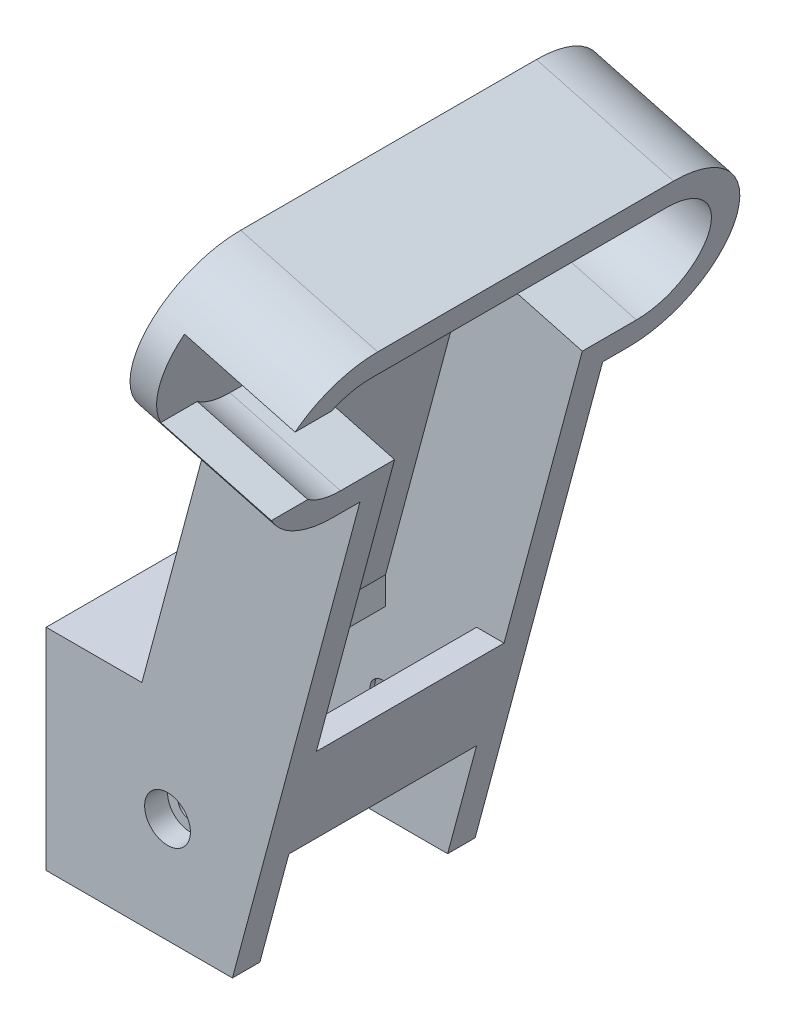
from build123d import *

# Parameters (mm, degrees)
SKETCH1_W                                = 53
SKETCH1_H                                = 53
SKETCH1_W_2                              = 41
SKETCH1_H_2                              = 41
BOSS_EXTRUDE1_DEPTH                      = 40
SKETCH2_W                                = 53
SKETCH2_H                                = 53
BOSS_EXTRUDE2_DEPTH                      = 6
SKETCH3_W                                = 53
SKETCH3_H                                = 80
SKETCH3_W_2                              = 41
SKETCH3_H_2                              = 68
BOSS_EXTRUDE3_DEPTH                      = 31
BOSS_EXTRUDE4_DEPTH                      = 31
BOSS_EXTRUDE5_START                      = -6
BOSS_EXTRUDE5_DEPTH                      = 6
SKETCH6_W                                = 41
SKETCH6_H                                = 12
CUT_EXTRUDE1_DEPTH                       = 25
CBORE_FOR_M3_SHCS2_D                     = 3.4
CBORE_FOR_M3_SHCS2_CBORE_D               = 6.5
CBORE_FOR_M3_SHCS2_CBORE_DEPTH           = 3
CUT_EXTRUDE2_REACH                       = 166.954
SKETCH14_W                               = 41
SKETCH14_H                               = 41
CUT_EXTRUDE3_DEPTH                       = 40
CUT_EXTRUDE4_REACH                       = 127.3
SKETCH15_W                               = 19.88190451
SKETCH15_H                               = 41
CBORE_FOR_M5_SHCS1_D                     = 5.5
CBORE_FOR_M5_SHCS1_DEPTH                 = 6
CBORE_FOR_M5_SHCS1_CBORE_D               = 10
CBORE_FOR_M5_SHCS1_CBORE_DEPTH           = 5
CBORE_FOR_M5_SHCS1_ON_FACE_2_D           = 5.5
CBORE_FOR_M5_SHCS1_ON_FACE_2_DEPTH       = 6
CBORE_FOR_M5_SHCS1_ON_FACE_2_CBORE_D     = 10
CBORE_FOR_M5_SHCS1_ON_FACE_2_CBORE_DEPTH = 5
CBORE_FOR_M5_SHCS1_ON_FACE_3_D           = 5.5
CBORE_FOR_M5_SHCS1_ON_FACE_3_DEPTH       = 6
CBORE_FOR_M5_SHCS1_ON_FACE_3_CBORE_D     = 10
CBORE_FOR_M5_SHCS1_ON_FACE_3_CBORE_DEPTH = 5
CUT_EXTRUDE5_START                       = -26.5
CUT_EXTRUDE5_DEPTH                       = 53


with BuildPart() as part:
    # Sketch1 → Boss-Extrude1 (new body)
    with BuildSketch(Plane(origin=(0, 0, 0), x_dir=(1, 0, 0), z_dir=(0, 1, 0))):
        Rectangle(SKETCH1_W, SKETCH1_H)
        Rectangle(SKETCH1_W_2, SKETCH1_H_2, mode=Mode.SUBTRACT)
    extrude(amount=BOSS_EXTRUDE1_DEPTH)

    # Sketch2 → Boss-Extrude2 (add)
    with BuildSketch(Plane(origin=(0, 40, 0), x_dir=(1, 0, 0), z_dir=(0, 1, 0))):
        Rectangle(SKETCH2_W, SKETCH2_H)
    extrude(amount=BOSS_EXTRUDE2_DEPTH)

    # Sketch3 → Boss-Extrude3 (add)
    with BuildSketch(Plane(origin=(13.2248366, -3.543584287, 0), x_dir=(0, 0, -1), z_dir=(-0.9659258262890681, 0.25881904510252135, 0))):
        with Locations((0, -71.291292705)):
            Rectangle(SKETCH3_W, SKETCH3_H)
        with Locations((0, -71.291292705)):
            Rectangle(SKETCH3_W_2, SKETCH3_H_2, mode=Mode.SUBTRACT)
    extrude(amount=BOSS_EXTRUDE3_DEPTH)

    # Sketch4 → Boss-Extrude4 (add)
    with BuildSketch(Plane(origin=(13.2248366, -3.543584287, 0), x_dir=(0, 0, -1), z_dir=(0.9659258262890681, -0.25881904510252135, 0))):
        with BuildLine():
            Line((-32.3, 148.691292705), (32.3, 148.691292705))
            ThreePointArc((32.3, 148.691292705), (51, 129.991292705), (32.3, 111.291292705))
            Line((32.3, 111.291292705), (-32.3, 111.291292705))
            ThreePointArc((-32.3, 111.291292705), (-51, 129.991292705), (-32.3, 148.691292705))
        make_face()
        with BuildLine():
            Line((-32.3, 142.691292705), (32.3, 142.691292705))
            ThreePointArc((32.3, 142.691292705), (45, 129.991292705), (32.3, 117.291292705))
            Line((32.3, 117.291292705), (-32.3, 117.291292705))
            ThreePointArc((-32.3, 117.291292705), (-45, 129.991292705), (-32.3, 142.691292705))
        make_face(mode=Mode.SUBTRACT)
    extrude(amount=-BOSS_EXTRUDE4_DEPTH)

    # Sketch5 → Boss-Extrude5 (add)
    with BuildSketch(Plane(origin=(-16.718864015, 4.479806111, 0), x_dir=(0, 0, 1), z_dir=(-0.9659258262890681, 0.25881904510252135, 0)).offset(BOSS_EXTRUDE5_START)):
        with BuildLine():
            Line((-20.5, 42.984867739), (20.5, 42.984867739))
            Line((20.5, 42.984867739), (26.5, 42.984867739))
            Line((26.5, 42.984867739), (26.5, 111.291292705))
            Line((26.5, 111.291292705), (32.3, 111.291292705))
            ThreePointArc((32.3, 111.291292705), (51, 129.991292705), (32.3, 148.691292705))
            Line((32.3, 148.691292705), (-32.3, 148.691292705))
            ThreePointArc((-32.3, 148.691292705), (-51, 129.991292705), (-32.3, 111.291292705))
            Line((-32.3, 111.291292705), (-26.5, 111.291292705))
            Line((-26.5, 111.291292705), (-26.5, 42.984867739))
            Line((-26.5, 42.984867739), (-20.5, 42.984867739))
        make_face()
    extrude(amount=BOSS_EXTRUDE5_DEPTH)

    # Sketch6 → Cut-Extrude1 (cut)
    with BuildSketch(Plane(origin=(13.2248366, -3.543584287, 0), x_dir=(0, 0, -1), z_dir=(0.9659258262890681, -0.25881904510252135, 0))):
        with Locations((0, 111.291292705)):
            Rectangle(SKETCH6_W, SKETCH6_H)
    extrude(amount=-CUT_EXTRUDE1_DEPTH, mode=Mode.SUBTRACT)

    # CBORE for M3 SHCS2 (through all)
    with Locations(Plane(origin=(-16.718864015, 4.479806111, 0), x_dir=(0, 0, 1), z_dir=(-0.9659258262890681, 0.25881904510252135, 0))):
        with Locations((22.5, 129.991292705), (-22.5, 129.991292705)):
            CounterBoreHole(CBORE_FOR_M3_SHCS2_D / 2, CBORE_FOR_M3_SHCS2_CBORE_D / 2, CBORE_FOR_M3_SHCS2_CBORE_DEPTH)

    # Sketch13 → Cut-Extrude2 (cut, up to next)
    with BuildSketch(Plane.XY, mode=Mode.PRIVATE) as cut_extrude2_sk1:
        Polygon((49.457249301, 131.677620792), (44.280868399, 112.359104266), (20.132722741, 118.829580394), (25.309103643, 138.148096919), align=None)
    cut_extrude2_tool1 = extrude(cut_extrude2_sk1.sketch, amount=CUT_EXTRUDE2_REACH, mode=Mode.PRIVATE) & part.part
    add(cut_extrude2_tool1.solids().sort_by_distance((34.794986, 125.253601, 0))[0], mode=Mode.SUBTRACT)

    # Sketch14 → Cut-Extrude3 (cut)
    with BuildSketch(Plane.XZ):
        Rectangle(SKETCH14_W, SKETCH14_H)
    extrude(amount=-CUT_EXTRUDE3_DEPTH, mode=Mode.SUBTRACT)

    # Sketch15 → Cut-Extrude4 (cut, up to next)
    with BuildSketch(Plane(origin=(0, 46, 0), x_dir=(1, 0, 0), z_dir=(0, 1, 0)), mode=Mode.PRIVATE) as cut_extrude4_sk1:
        with Locations((10.559047745, 0)):
            Rectangle(SKETCH15_W, SKETCH15_H)
    cut_extrude4_tool1 = extrude(cut_extrude4_sk1.sketch, amount=-CUT_EXTRUDE4_REACH, mode=Mode.PRIVATE) & part.part
    add(cut_extrude4_tool1.solids().sort_by_distance((10.559048, 46, 0))[0], mode=Mode.SUBTRACT)

    # CBORE for M5 SHCS1
    with Locations(Plane(origin=(0, 23, -26.5), x_dir=(-1, 0, 0), z_dir=(0, 0, -1))):
        with Locations((0, 0)):
            CounterBoreHole(CBORE_FOR_M5_SHCS1_D / 2, CBORE_FOR_M5_SHCS1_CBORE_D / 2, CBORE_FOR_M5_SHCS1_CBORE_DEPTH, depth=CBORE_FOR_M5_SHCS1_DEPTH)

    # CBORE for M5 SHCS1 on face 2
    with Locations(Plane(origin=(-26.5, 23, 0), x_dir=(0, 0, -1), z_dir=(-1, 0, 0))):
        with Locations((0, 0)):
            CounterBoreHole(CBORE_FOR_M5_SHCS1_ON_FACE_2_D / 2, CBORE_FOR_M5_SHCS1_ON_FACE_2_CBORE_D / 2, CBORE_FOR_M5_SHCS1_ON_FACE_2_CBORE_DEPTH, depth=CBORE_FOR_M5_SHCS1_ON_FACE_2_DEPTH)

    # CBORE for M5 SHCS1 on face 3
    with Locations(Plane(origin=(0, 23, 26.5), x_dir=(1, 0, 0), z_dir=(0, 0, 1))):
        with Locations((0, 0)):
            CounterBoreHole(CBORE_FOR_M5_SHCS1_ON_FACE_3_D / 2, CBORE_FOR_M5_SHCS1_ON_FACE_3_CBORE_D / 2, CBORE_FOR_M5_SHCS1_ON_FACE_3_CBORE_DEPTH, depth=CBORE_FOR_M5_SHCS1_ON_FACE_3_DEPTH)

    # Cut-Extrude5: read off the stored shape, not the designer's step
    # Cut-Extrude5 outline → Cut-Extrude5 (cut)
    with BuildSketch(Plane.XY.offset(CUT_EXTRUDE5_START)):
        Polygon((14.174337148, 0), (26.5, 0), (26.5, 46), align=None)
    extrude(amount=CUT_EXTRUDE5_DEPTH, mode=Mode.SUBTRACT)


solid = part.part
